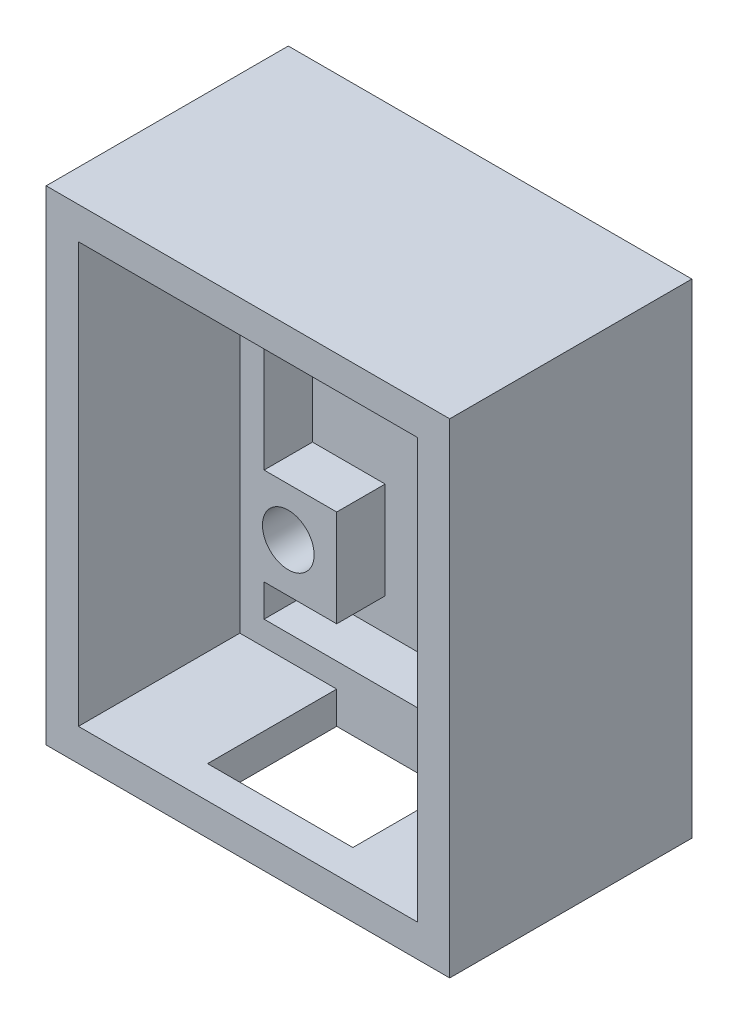
from build123d import *

# Parameters (mm, degrees)
SKETCH_1_W          = 25
SKETCH_1_H          = 30
EXTRUDE_1_DEPTH     = 15
SKETCH_2_W          = 21
SKETCH_2_H          = 26
CUT_EXTRUDE_1_DEPTH = 13
SKETCH_3_W          = 21
SKETCH_3_H          = 26
SKETCH_3_W_2        = 18
SKETCH_3_H_2        = 23
EXTRUDE_2_DEPTH     = 3
SKETCH_5_W          = 4.5
SKETCH_5_H          = 6
EXTRUDE_3_DEPTH     = 3
SKETCH_6_R          = 1.6
CUT_EXTRUDE_2_DEPTH = 94.778887913
SKETCH_7_W          = 9
SKETCH_7_H          = 8
CUT_EXTRUDE_3_DEPTH = 90.714734825


with BuildPart() as part:
    # ｽｹｯﾁ1 → ﾎﾞｽ - 押し出し1 (new body)
    with BuildSketch(Plane.XY):
        with Locations((-71.40312059, 25.678571429)):
            Rectangle(SKETCH_1_W, SKETCH_1_H)
    extrude(amount=EXTRUDE_1_DEPTH)

    # ｽｹｯﾁ2 → ｶｯﾄ - 押し出し1 (cut)
    with BuildSketch(Plane.XY.offset(15)):
        with Locations((-71.40312059, 25.678571429)):
            Rectangle(SKETCH_2_W, SKETCH_2_H)
    extrude(amount=-CUT_EXTRUDE_1_DEPTH, mode=Mode.SUBTRACT)

    # ｽｹｯﾁ3 → ﾎﾞｽ - 押し出し2 (add)
    with BuildSketch(Plane.XY.offset(2)):
        with Locations((-71.40312059, 25.678571429)):
            Rectangle(SKETCH_3_W, SKETCH_3_H)
        with Locations((-71.40312059, 25.678571429)):
            Rectangle(SKETCH_3_W_2, SKETCH_3_H_2, mode=Mode.SUBTRACT)
    extrude(amount=EXTRUDE_2_DEPTH)

    # ｽｹｯﾁ5 → ﾎﾞｽ - 押し出し3 (add)
    with BuildSketch(Plane.XY.offset(2)):
        with Locations((-64.65312059, 19.178571429)):
            Rectangle(SKETCH_5_W, SKETCH_5_H)
        with Locations((-78.15312059, 19.178571429)):
            Rectangle(SKETCH_5_W, SKETCH_5_H)
    extrude(amount=EXTRUDE_3_DEPTH)

    # ｽｹｯﾁ6 → ｶｯﾄ - 押し出し2 (cut, through all)
    with BuildSketch(Plane.XY.offset(5)):
        with Locations((-63.90312059, 19.178571429)):
            Circle(SKETCH_6_R)
        with Locations((-78.90312059, 19.178571429)):
            Circle(SKETCH_6_R)
    extrude(amount=-CUT_EXTRUDE_2_DEPTH, mode=Mode.SUBTRACT)

    # ｽｹｯﾁ7 → ｶｯﾄ - 押し出し3 (cut, through all)
    with BuildSketch(Plane(origin=(0, 12.678571429, 0), x_dir=(1, 0, 0), z_dir=(0, 1, 0))):
        with Locations((-71.40312059, -9)):
            Rectangle(SKETCH_7_W, SKETCH_7_H)
    extrude(amount=-CUT_EXTRUDE_3_DEPTH, mode=Mode.SUBTRACT)


solid = part.part
